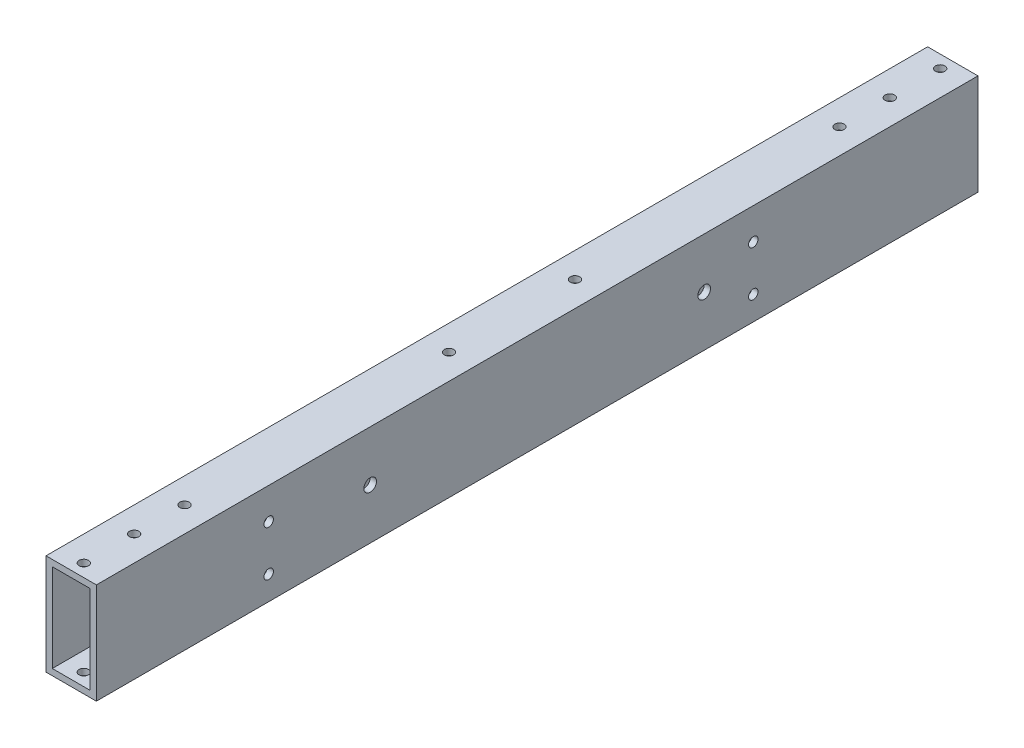
from build123d import *

# Parameters (mm, degrees)
SKETCH1_W           = 25.4
SKETCH1_H           = 50.8
BOSS_EXTRUDE1_DEPTH = 444.5
SHELL1_T            = -3.175
SKETCH2_R           = 2.38125
CUT_EXTRUDE1_DEPTH  = 448.573658742
SKETCH3_R           = 3.175
CUT_EXTRUDE2_DEPTH  = 446.949066598
SKETCH4_R           = 2.38125
CUT_EXTRUDE3_DEPTH  = 448.573658742
SKETCH5_R           = 2.38125
CUT_EXTRUDE4_DEPTH  = 446.949066598


with BuildPart() as part:
    # Sketch1 → Boss-Extrude1 (new body)
    with BuildSketch(Plane.XY):
        Rectangle(SKETCH1_W, SKETCH1_H)
    extrude(amount=BOSS_EXTRUDE1_DEPTH)

    # Shell1
    shell1_openings = [part.faces().sort_by_distance(p)[0] for p in [
        (0, 0, 0),
        (0, 0, 444.5),
    ]]
    offset(amount=SHELL1_T, openings=shell1_openings, kind=Kind.INTERSECTION)

    # Sketch2 → Cut-Extrude1 (cut, through all)
    with BuildSketch(Plane(origin=(0, 25.4, 0), x_dir=(1, 0, 0), z_dir=(0, 1, 0))):
        with Locations((0, -6.35)):
            Circle(SKETCH2_R)
        with Locations((0, -31.75)):
            Circle(SKETCH2_R)
        with Locations((0, -57.15)):
            Circle(SKETCH2_R)
        with Locations((0, -387.35)):
            Circle(SKETCH2_R)
        with Locations((0, -412.75)):
            Circle(SKETCH2_R)
        with Locations((0, -438.15)):
            Circle(SKETCH2_R)
    extrude(amount=-CUT_EXTRUDE1_DEPTH, mode=Mode.SUBTRACT)

    # Sketch3 → Cut-Extrude2 (cut, through all)
    with BuildSketch(Plane.ZY.offset(12.7)):
        with Locations((138.049, 0)):
            Circle(SKETCH3_R)
        with Locations((306.451, 0)):
            Circle(SKETCH3_R)
    extrude(amount=-CUT_EXTRUDE2_DEPTH, mode=Mode.SUBTRACT)

    # Sketch4 → Cut-Extrude3 (cut, through all)
    with BuildSketch(Plane(origin=(0, 25.4, 0), x_dir=(1, 0, 0), z_dir=(0, 1, 0))):
        with Locations((0, -190.5)):
            Circle(SKETCH4_R)
        with Locations((0, -254)):
            Circle(SKETCH4_R)
    extrude(amount=-CUT_EXTRUDE3_DEPTH, mode=Mode.SUBTRACT)

    # Sketch5 → Cut-Extrude4 (cut, through all)
    with BuildSketch(Plane.ZY.offset(12.7)):
        with Locations((357.632, 9.525)):
            Circle(SKETCH5_R)
        with Locations((357.632, -13.335)):
            Circle(SKETCH5_R)
        with Locations((113.284, 9.525)):
            Circle(SKETCH5_R)
        with Locations((113.284, -13.335)):
            Circle(SKETCH5_R)
    extrude(amount=-CUT_EXTRUDE4_DEPTH, mode=Mode.SUBTRACT)


solid = part.part
